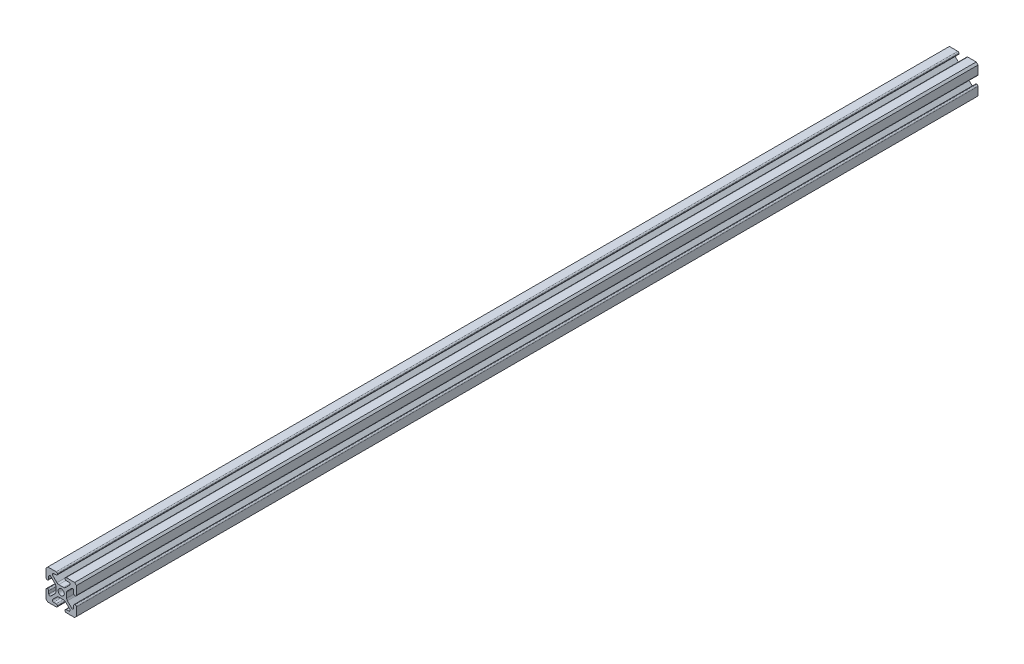
from build123d import *

# Parameters (mm, degrees)
BOSS_EXTRUDE1_DEPTH = 752.4


with BuildPart() as part:
    # Sketch1 → Boss-Extrude1 (new body)
    with BuildSketch(Plane.XY):
        with BuildLine():
            Line((-11.199951579, -12.7), (-4.222256762, -12.7))
            ThreePointArc((-4.222256762, -12.7), (-3.503836272, -12.40242049), (-3.206256762, -11.684))
            Line((-3.206256762, -11.684), (-3.206256762, -11.440665395))
            ThreePointArc((-3.206256762, -11.440665395), (-3.503836272, -10.722244905), (-4.222256762, -10.424665395))
            Line((-4.222256762, -10.424665395), (-6.40926672, -10.424665395))
            ThreePointArc((-6.40926672, -10.424665395), (-7.347928334, -9.797471742), (-7.127687178, -8.690244874))
            Line((-7.127687178, -8.690244874), (-3.593166694, -5.155724698))
            ThreePointArc((-3.593166694, -5.155724698), (-2.876257435, -4.67670128), (-2.030605322, -4.508490626))
            Line((-2.030605322, -4.508490626), (2.030598864, -4.508490626))
            ThreePointArc((2.030598864, -4.508490626), (2.876251031, -4.676701303), (3.593160319, -5.155724782))
            Line((3.593160319, -5.155724782), (7.127680379, -8.690244912))
            ThreePointArc((7.127680379, -8.690244912), (7.347921489, -9.019859032), (7.425259882, -9.408665395))
            ThreePointArc((7.425259882, -9.408665395), (7.127680372, -10.127085884), (6.409259882, -10.424665395))
            Line((6.409259882, -10.424665395), (4.22225065, -10.424665395))
            ThreePointArc((4.22225065, -10.424665395), (3.50383016, -10.722244905), (3.20625065, -11.440665395))
            Line((3.20625065, -11.440665395), (3.20625065, -11.684))
            ThreePointArc((3.20625065, -11.684), (3.50383016, -12.40242049), (4.22225065, -12.7))
            Line((4.22225065, -12.7), (11.199952422, -12.7))
            Line((11.199952422, -12.7), (12.7, -11.199951732))
            Line((12.7, -11.199951732), (12.7, -4.222256762))
            ThreePointArc((12.7, -4.222256762), (12.40242049, -3.503836272), (11.684, -3.206256762))
            Line((11.684, -3.206256762), (11.440665395, -3.206256762))
            ThreePointArc((11.440665395, -3.206256762), (10.722244905, -3.503836272), (10.424665395, -4.222256762))
            Line((10.424665395, -4.222256762), (10.424665395, -6.40926672))
            ThreePointArc((10.424665395, -6.40926672), (9.797471742, -7.347928334), (8.690244874, -7.127687178))
            Line((8.690244874, -7.127687178), (5.155724698, -3.593166694))
            ThreePointArc((5.155724698, -3.593166694), (4.67670128, -2.876257435), (4.508490626, -2.030605322))
            Line((4.508490626, -2.030605322), (4.508490626, 2.030598864))
            ThreePointArc((4.508490626, 2.030598864), (4.676701303, 2.876251031), (5.155724782, 3.593160319))
            Line((5.155724782, 3.593160319), (8.690244912, 7.127680379))
            ThreePointArc((8.690244912, 7.127680379), (9.019859032, 7.347921489), (9.408665395, 7.425259882))
            ThreePointArc((9.408665395, 7.425259882), (10.127085884, 7.127680372), (10.424665395, 6.409259882))
            Line((10.424665395, 6.409259882), (10.424665395, 4.22225065))
            ThreePointArc((10.424665395, 4.22225065), (10.722244905, 3.50383016), (11.440665395, 3.20625065))
            Line((11.440665395, 3.20625065), (11.684, 3.20625065))
            ThreePointArc((11.684, 3.20625065), (12.40242049, 3.50383016), (12.7, 4.22225065))
            Line((12.7, 4.22225065), (12.7, 11.199954756))
            Line((12.7, 11.199954756), (11.199954423, 12.7))
            Line((11.199954423, 12.7), (4.222256762, 12.7))
            ThreePointArc((4.222256762, 12.7), (3.503836272, 12.40242049), (3.206256762, 11.684))
            Line((3.206256762, 11.684), (3.206256762, 11.440665395))
            ThreePointArc((3.206256762, 11.440665395), (3.503836272, 10.722244905), (4.222256762, 10.424665395))
            Line((4.222256762, 10.424665395), (6.40926672, 10.424665395))
            ThreePointArc((6.40926672, 10.424665395), (7.347928334, 9.797471742), (7.127687178, 8.690244874))
            Line((7.127687178, 8.690244874), (3.593166694, 5.155724698))
            ThreePointArc((3.593166694, 5.155724698), (2.876257435, 4.67670128), (2.030605322, 4.508490626))
            Line((2.030605322, 4.508490626), (-2.030598864, 4.508490626))
            ThreePointArc((-2.030598864, 4.508490626), (-2.876251031, 4.676701303), (-3.593160319, 5.155724782))
            Line((-3.593160319, 5.155724782), (-7.127680379, 8.690244912))
            ThreePointArc((-7.127680379, 8.690244912), (-7.347921489, 9.019859032), (-7.425259882, 9.408665395))
            ThreePointArc((-7.425259882, 9.408665395), (-7.127680372, 10.127085884), (-6.409259882, 10.424665395))
            Line((-6.409259882, 10.424665395), (-4.22225065, 10.424665395))
            ThreePointArc((-4.22225065, 10.424665395), (-3.50383016, 10.722244905), (-3.20625065, 11.440665395))
            Line((-3.20625065, 11.440665395), (-3.20625065, 11.684))
            ThreePointArc((-3.20625065, 11.684), (-3.50383016, 12.40242049), (-4.22225065, 12.7))
            Line((-4.22225065, 12.7), (-11.199951733, 12.7))
            Line((-11.199951733, 12.7), (-12.7, 11.1999514))
            Line((-12.7, 11.1999514), (-12.7, 4.222256762))
            ThreePointArc((-12.7, 4.222256762), (-12.40242049, 3.503836272), (-11.684, 3.206256762))
            Line((-11.684, 3.206256762), (-11.440665395, 3.206256762))
            ThreePointArc((-11.440665395, 3.206256762), (-10.722244905, 3.503836272), (-10.424665395, 4.222256762))
            Line((-10.424665395, 4.222256762), (-10.424665395, 6.40926672))
            ThreePointArc((-10.424665395, 6.40926672), (-9.797471742, 7.347928334), (-8.690244874, 7.127687178))
            Line((-8.690244874, 7.127687178), (-5.155724698, 3.593166694))
            ThreePointArc((-5.155724698, 3.593166694), (-4.67670128, 2.876257435), (-4.508490626, 2.030605322))
            Line((-4.508490626, 2.030605322), (-4.508490626, -2.030598864))
            ThreePointArc((-4.508490626, -2.030598864), (-4.676701303, -2.876251031), (-5.155724782, -3.593160319))
            Line((-5.155724782, -3.593160319), (-8.690244912, -7.127680379))
            ThreePointArc((-8.690244912, -7.127680379), (-9.019859032, -7.347921489), (-9.408665395, -7.425259882))
            ThreePointArc((-9.408665395, -7.425259882), (-10.127085884, -7.127680372), (-10.424665395, -6.409259882))
            Line((-10.424665395, -6.409259882), (-10.424665395, -4.22225065))
            ThreePointArc((-10.424665395, -4.22225065), (-10.722244905, -3.50383016), (-11.440665395, -3.20625065))
            Line((-11.440665395, -3.20625065), (-11.684, -3.20625065))
            ThreePointArc((-11.684, -3.20625065), (-12.40242049, -3.50383016), (-12.7, -4.22225065))
            Line((-12.7, -4.22225065), (-12.7, -11.199952268))
            Line((-12.7, -11.199952268), (-11.199951579, -12.7))
        make_face()
        with BuildLine():
            ThreePointArc((-2.55499489, 0), (0, -2.55499489), (2.55499489, 0))
            ThreePointArc((2.55499489, 0), (0, 2.55499489), (-2.55499489, 0))
        make_face(mode=Mode.SUBTRACT)
    extrude(amount=BOSS_EXTRUDE1_DEPTH)


solid = part.part
